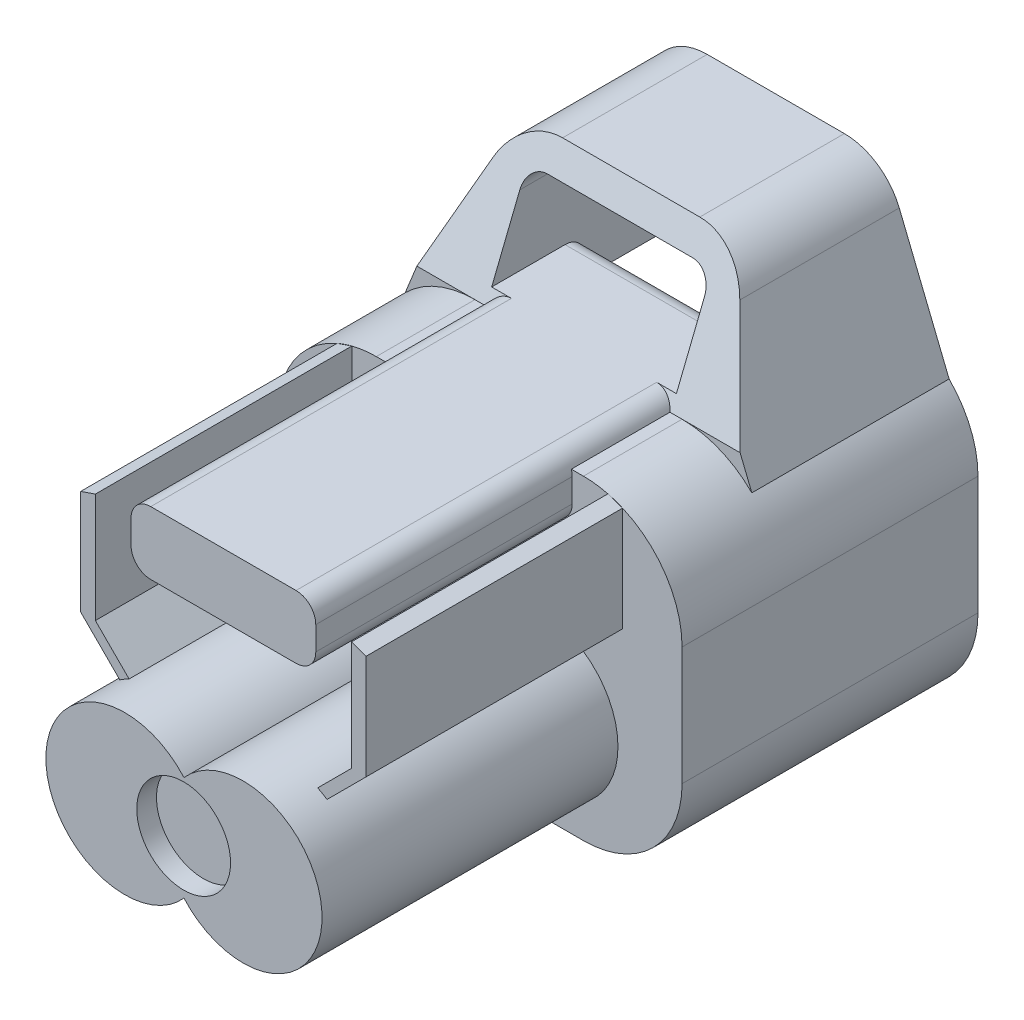
from build123d import *

# Parameters (mm, degrees)
EXTRUDE_1_DEPTH      = 15
EXTRUDE_2_DEPTH      = 15
EXTRUDE_3_DEPTH      = 13
EXTRUDE_4_DEPTH      = 10
CUT_EXTRUDE_2_DEPTH  = 43.818428432
CUT_EXTRUDE_3_DEPTH  = 10
EXTRUDE_5_DEPTH      = 13
EXTRUDE_5_DEPTH_BACK = 10
SKETCH_7_W           = 9.36410038
SKETCH_7_H           = 3.199645584
FILLET_1_R           = 1
SKETCH_8_R           = 2.377718278
CUT_EXTRUDE_4_DEPTH  = 1


with BuildPart() as part:
    # ｽｹｯﾁ1 → ﾎﾞｽ - 押し出し1 (new body)
    with BuildSketch(Plane.XY):
        with BuildLine():
            Line((5, 0), (15.5, 0))
            ThreePointArc((15.5, 0), (19.035533906, 1.464466094), (20.5, 5))
            Line((20.5, 5), (20.5, 11))
            ThreePointArc((20.5, 11), (19.035533906, 14.535533906), (15.5, 16))
            Line((15.5, 16), (5, 16))
            ThreePointArc((5, 16), (1.464466094, 14.535533906), (0, 11))
            Line((0, 11), (0, 5))
            ThreePointArc((0, 5), (1.464466094, 1.464466094), (5, 0))
        make_face()
    extrude(amount=EXTRUDE_1_DEPTH)

    # ｽｹｯﾁ2 → ﾎﾞｽ - 押し出し2 (add)
    with BuildSketch(Plane.XY.offset(15)):
        with BuildLine():
            ThreePointArc((10.25, 7.645751311), (3.25, 5), (10.25, 2.354248689))
            ThreePointArc((10.25, 2.354248689), (17.25, 5), (10.25, 7.645751311))
        make_face()
    extrude(amount=EXTRUDE_2_DEPTH)

    # ｽｹｯﾁ3 → ﾎﾞｽ - 押し出し3 (add)
    with BuildSketch(Plane.XY.offset(15)):
        Polygon((5, 8.307189139), (3.015149344, 10.292039795), (3.015149344, 15.589157643), (3.760031936, 15.843808337), (3.760031936, 10.292039795), (5.469966234, 8.582105497), align=None)
        Polygon((15.5, 8.307189139), (15.030033766, 8.582105497), (16.739968064, 10.292039795), (16.739968064, 15.843808337), (17.484850656, 15.589157643), (17.484850656, 10.292039795), align=None)
    extrude(amount=EXTRUDE_3_DEPTH)

    # ｽｹｯﾁ4 → ﾎﾞｽ - 押し出し4 (add)
    with BuildSketch(Plane(origin=(0, 0, 0), x_dir=(-1, 0, 0), z_dir=(0, 0, -1))):
        with BuildLine():
            Line((-19.035533906, 14.535533906), (-16.508167917, 20.778897002))
            ThreePointArc((-16.508167917, 20.778897002), (-15.404115105, 22.140884029), (-13.727372471, 22.653207574))
            Line((-13.727372471, 22.653207574), (-6.772627529, 22.653207574))
            ThreePointArc((-6.772627529, 22.653207574), (-5.095884895, 22.140884029), (-3.991832083, 20.778897002))
            Line((-3.991832083, 20.778897002), (-1.464466094, 14.535533906))
            Line((-1.464466094, 14.535533906), (-19.035533906, 14.535533906))
        make_face()
    extrude(amount=-EXTRUDE_4_DEPTH)

    # ｽｹｯﾁ5 → ｶｯﾄ - 押し出し2 (cut, through all)
    with BuildSketch(Plane(origin=(0, 0, 0), x_dir=(0, 0, -1), z_dir=(1, 0, 0))):
        Polygon((-10, 16), (-7.328208582, 22.653207574), (-10, 22.653207574), align=None)
    extrude(amount=CUT_EXTRUDE_2_DEPTH, mode=Mode.SUBTRACT)

    # ｽｹｯﾁ6 → ｶｯﾄ - 押し出し3 (cut)
    with BuildSketch(Plane(origin=(0, 0, 0), x_dir=(-1, 0, 0), z_dir=(0, 0, -1))):
        with BuildLine():
            Line((-14.93205019, 14.761085745), (-14.93205019, 20.248440553))
            ThreePointArc((-14.93205019, 20.248440553), (-14.639156971, 20.955547334), (-13.93205019, 21.248440553))
            Line((-13.93205019, 21.248440553), (-6.56794981, 21.248440553))
            ThreePointArc((-6.56794981, 21.248440553), (-5.860843029, 20.955547334), (-5.56794981, 20.248440553))
            Line((-5.56794981, 20.248440553), (-5.56794981, 14.761085745))
            add(Edge.make_bspline(
                [(-2.310743979, 13.961064345), (-3.233908529, 14.632656192), (-4.458845113, 14.799104366), (-5.56794981, 14.761085745)],
                knots=[0, 0, 0, 0, 1, 1, 1, 1], degree=3))
            ThreePointArc((-2.310743979, 13.961064345), (-1.342335165, 12.619100972), (-1, 11))
            Line((-1, 11), (-1, 5))
            ThreePointArc((-1, 5), (-2.171572875, 2.171572875), (-5, 1))
            Line((-5, 1), (-15.5, 1))
            ThreePointArc((-15.5, 1), (-18.328427125, 2.171572875), (-19.5, 5))
            Line((-19.5, 5), (-19.5, 11))
            ThreePointArc((-19.5, 11), (-19.157664835, 12.619100972), (-18.189256021, 13.961064345))
            add(Edge.make_bspline(
                [(-18.189256021, 13.961064345), (-17.266091471, 14.632656192), (-16.041154887, 14.799104366), (-14.93205019, 14.761085745)],
                knots=[0, 0, 0, 0, 1, 1, 1, 1], degree=3))
        make_face()
    extrude(amount=-CUT_EXTRUDE_3_DEPTH, mode=Mode.SUBTRACT)

    # ｽｹｯﾁ7 → ﾎﾞｽ - 押し出し5 (add, two sides: drawn at the far end of the back side and taken through both)
    with BuildSketch(Plane.XY.offset(15).offset(-EXTRUDE_5_DEPTH_BACK)):
        with Locations((10.25, 15.098663031)):
            Rectangle(SKETCH_7_W, SKETCH_7_H)
    extrude(amount=EXTRUDE_5_DEPTH + EXTRUDE_5_DEPTH_BACK)

    # ﾌｨﾚｯﾄ1
    # the kernel refuses this fillet: 1 mm, written as the material it takes off along each edge
    with BuildSketch(Plane(origin=(14.93205019, 16.698485823, 5), x_dir=(0, 0, 1), z_dir=(-1, 0, 0))) as fillet_1_piece_1:
        with BuildLine():
            CenterArc((FILLET_1_R, -FILLET_1_R), FILLET_1_R, 90, 90)
            Line((0, -FILLET_1_R), (0, 0))
            Line((0, 0), (FILLET_1_R, 0))
        make_face()
    extrude(amount=9.36410038, mode=Mode.SUBTRACT)
    with BuildSketch(Plane(origin=(14.93205019, 13.498840239, 2.5), x_dir=(0, 1, 0), z_dir=(0, 0, 1))) as fillet_1_piece_2:
        with BuildLine():
            CenterArc((FILLET_1_R, FILLET_1_R), FILLET_1_R, 180, 90)
            Line((0, FILLET_1_R), (0, 0))
            Line((0, 0), (FILLET_1_R, 0))
        make_face()
    extrude(amount=7.5, mode=Mode.SUBTRACT)
    with BuildSketch(Plane(origin=(5.56794981, 13.498840239, 2.5), x_dir=(0, 1, 0), z_dir=(0, 0, 1))) as fillet_1_piece_3:
        with BuildLine():
            CenterArc((FILLET_1_R, -FILLET_1_R), FILLET_1_R, 90, 90)
            Line((0, -FILLET_1_R), (0, 0))
            Line((0, 0), (FILLET_1_R, 0))
        make_face()
    extrude(amount=7.5, mode=Mode.SUBTRACT)
    with BuildSketch(Plane(origin=(5.56794981, 13.498840239, 15), x_dir=(0, 1, 0), z_dir=(0, 0, 1)), Plane(origin=(14.93205019, 13.498840239, 15), x_dir=(-1, 0, 0), z_dir=(0, 0, 1))) as fillet_1_piece_4:
        with BuildLine():
            CenterArc((FILLET_1_R, -FILLET_1_R), FILLET_1_R, 90, 90)
            Line((0, -FILLET_1_R), (0, 0))
            Line((0, 0), (FILLET_1_R, 0))
        make_face()
    extrude(amount=15.5, mode=Mode.SUBTRACT)
    with BuildSketch(Plane(origin=(14.93205019, 16.698485823, 30.5), x_dir=(0, -1, 0), z_dir=(0, 0, -1))) as fillet_1_piece_5_section:
        with BuildLine():
            CenterArc((FILLET_1_R, FILLET_1_R), FILLET_1_R, 180, 90)
            Line((0, FILLET_1_R), (0, 0))
            Line((0, 0), (FILLET_1_R, 0))
        make_face()
    fillet_1_piece_5 = extrude(amount=23.280497551, mode=Mode.PRIVATE)
    fillet_1_piece_5 = split(fillet_1_piece_5, bisect_by=Plane(origin=(14.918146213, 15.92497671, 15), z_dir=(0, 0, 1)), keep=Keep.TOP, mode=Mode.PRIVATE)
    add(fillet_1_piece_5, mode=Mode.SUBTRACT)
    with BuildSketch(Plane(origin=(14.93205019, 16.698485823, 30.5), x_dir=(0, -1, 0), z_dir=(0, 0, -1))) as fillet_1_piece_6_section:
        with BuildLine():
            CenterArc((FILLET_1_R, FILLET_1_R), FILLET_1_R, 180, 90)
            Line((0, FILLET_1_R), (0, 0))
            Line((0, 0), (FILLET_1_R, 0))
        make_face()
    fillet_1_piece_6 = extrude(amount=23.280497551, mode=Mode.PRIVATE)
    fillet_1_piece_6 = split(fillet_1_piece_6, bisect_by=Plane(origin=(14.70262804, 15.590982586, 10.164252987), z_dir=(0, 0.3726538497201509, 0.927970424253247)), keep=Keep.TOP, mode=Mode.PRIVATE)
    fillet_1_piece_6 = split(fillet_1_piece_6, bisect_by=Plane(origin=(14.70262804, 16, 12.401713298), z_dir=(0, 1, 0)), keep=Keep.TOP, mode=Mode.PRIVATE)
    add(fillet_1_piece_6, mode=Mode.SUBTRACT)
    with BuildSketch(Plane(origin=(5.56794981, 16.698485823, 30.5), x_dir=(0, -1, 0), z_dir=(0, 0, -1))) as fillet_1_piece_7_section:
        with BuildLine():
            CenterArc((FILLET_1_R, -FILLET_1_R), FILLET_1_R, 90, 90)
            Line((0, -FILLET_1_R), (0, 0))
            Line((0, 0), (FILLET_1_R, 0))
        make_face()
    fillet_1_piece_7 = extrude(amount=23.280497551, mode=Mode.PRIVATE)
    fillet_1_piece_7 = split(fillet_1_piece_7, bisect_by=Plane(origin=(5.581853787, 15.92497671, 15), z_dir=(0, 0, 1)), keep=Keep.TOP, mode=Mode.PRIVATE)
    add(fillet_1_piece_7, mode=Mode.SUBTRACT)
    with BuildSketch(Plane(origin=(5.56794981, 16.698485823, 30.5), x_dir=(0, -1, 0), z_dir=(0, 0, -1))) as fillet_1_piece_8_section:
        with BuildLine():
            CenterArc((FILLET_1_R, -FILLET_1_R), FILLET_1_R, 90, 90)
            Line((0, -FILLET_1_R), (0, 0))
            Line((0, 0), (FILLET_1_R, 0))
        make_face()
    fillet_1_piece_8 = extrude(amount=23.280497551, mode=Mode.PRIVATE)
    fillet_1_piece_8 = split(fillet_1_piece_8, bisect_by=Plane(origin=(5.79737196, 16, 12.401713298), z_dir=(0, 1, 0)), keep=Keep.TOP, mode=Mode.PRIVATE)
    fillet_1_piece_8 = split(fillet_1_piece_8, bisect_by=Plane(origin=(5.79737196, 15.590982586, 10.164252987), z_dir=(0, 0.3726538497201509, 0.927970424253247)), keep=Keep.TOP, mode=Mode.PRIVATE)
    add(fillet_1_piece_8, mode=Mode.SUBTRACT)

    # ｽｹｯﾁ8 → ｶｯﾄ - 押し出し4 (cut)
    with BuildSketch(Plane.XY.offset(30)):
        with Locations((10.235322727, 5.074085352)):
            Circle(SKETCH_8_R)
    extrude(amount=-CUT_EXTRUDE_4_DEPTH, mode=Mode.SUBTRACT)


solid = part.part
